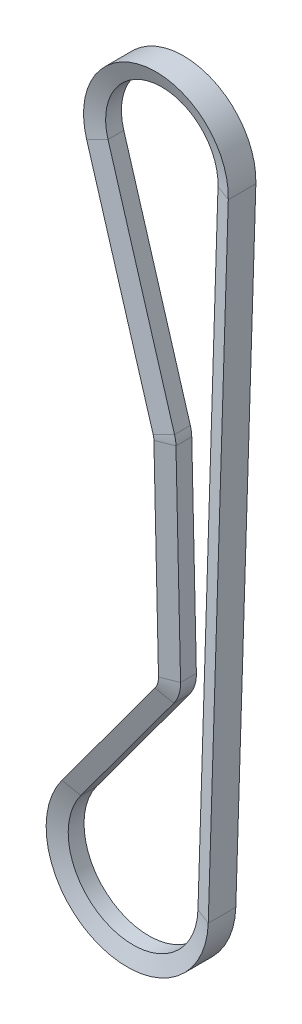
from build123d import *


with BuildPart() as part:
    # Sweep1: sweep along a path in Sketch2
    with BuildLine(Plane.XY) as sweep1_path:
        Line((24.987611671, -0.786932631), (18.063248401, -220.657469978))
        ThreePointArc((18.063248401, -220.657469978), (-19.073062721, -246.238797948), (-32.475962713, -203.182181543))
        Line((-32.475962713, -203.182181543), (-0.346480296, -159.51445194))
        ThreePointArc((-0.346480296, -159.51445194), (0.59420194, -157.662896053), (0.887161402, -155.606852029))
        Line((0.887161402, -155.606852029), (-0.703933402, -85.624937099))
        ThreePointArc((-0.703933402, -85.624937099), (-0.780173817, -84.777796907), (-0.968947473, -83.948445586))
        Line((-0.968947473, -83.948445586), (-23.950178562, -7.168608433))
        ThreePointArc((-23.950178562, -7.168608433), (-3.232725379, 24.790108645), (24.987611671, -0.786932631))
    # Sketch3 → Sweep1 (sweep)
    with BuildSketch(Plane(origin=(-23.950178562, -7.168608433, 0), x_dir=(0.9580071424601593, 0.28674433733784555, 0), z_dir=(-0.28674433733784555, 0.9580071424601593, 0))):
        Polygon((0, -4.7625), (0, 4.7625), (5.588, 2.728634331), (5.588, -2.728634331), align=None)
    sweep(path=sweep1_path.line)


solid = part.part
